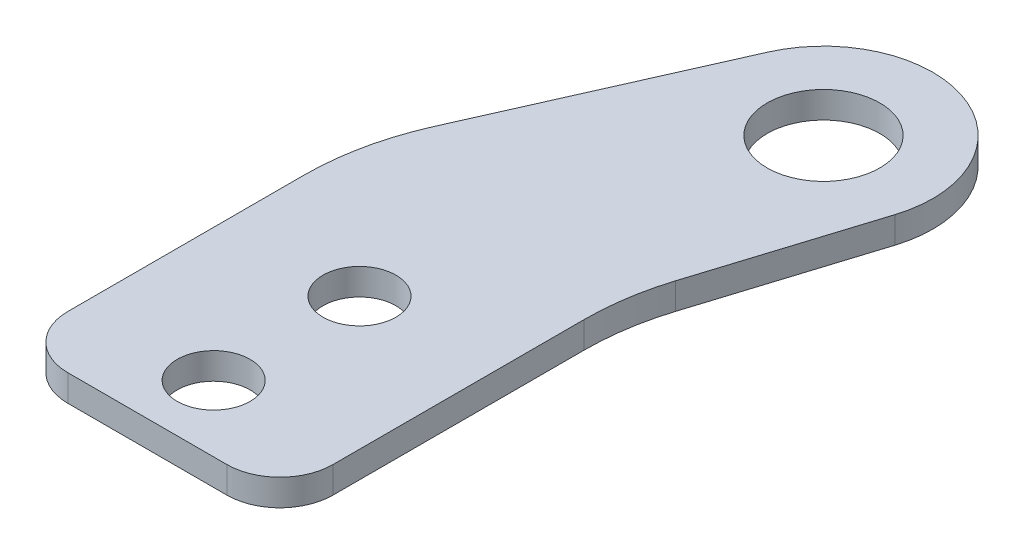
from build123d import *

# Parameters (mm, degrees)
SKETCH1_R            = 4.25
BASE_FLANGE1_DEPTH   = 2
FILLET1_R            = 20
M5_CLEARANCE_HOLE1_D = 5.5
FILLET2_R            = 4


# Sheet-metal steps are written as plain solids
with BuildPart() as part:
    # Sketch1 → Base-Flange1 (new body)
    with BuildSketch(Plane(origin=(0, 0, 0), x_dir=(1, 0, 0), z_dir=(0, 1, 0))):
        with BuildLine():
            Line((-10, 0), (10, 0))
            Line((10, 0), (10, 26))
            Line((10, 26), (14.871793605, 41.530715601))
            ThreePointArc((14.871793605, 41.530715601), (9.910471049, 51.719563347), (-0.542628251, 47.342343349))
            Line((-0.542628251, 47.342343349), (-10, 26))
            Line((-10, 26), (-10, 0))
        make_face()
        with Locations(Location((7, 44, 0), (0, 0, 270))):
            Circle(SKETCH1_R, mode=Mode.SUBTRACT)
    extrude(amount=-BASE_FLANGE1_DEPTH)

    # Fillet1
    fillet1_edges = [part.edges().sort_by_distance(p)[0] for p in [
        (-10, -1, -26),
        (10, -1, -26),
    ]]
    fillet(fillet1_edges, radius=FILLET1_R)

    # M5 Clearance Hole1 (through all)
    with Locations(Plane(origin=(0, 0, 0), x_dir=(1, 0, 0), z_dir=(0, 1, 0))):
        with Locations((0, 16), (0, 5)):
            Hole(M5_CLEARANCE_HOLE1_D / 2)

    # Fillet2
    fillet2_edges = [part.edges().sort_by_distance(p)[0] for p in [
        (10, -1, 0),
        (-10, -1, 0),
    ]]
    fillet(fillet2_edges, radius=FILLET2_R)


solid = part.part
